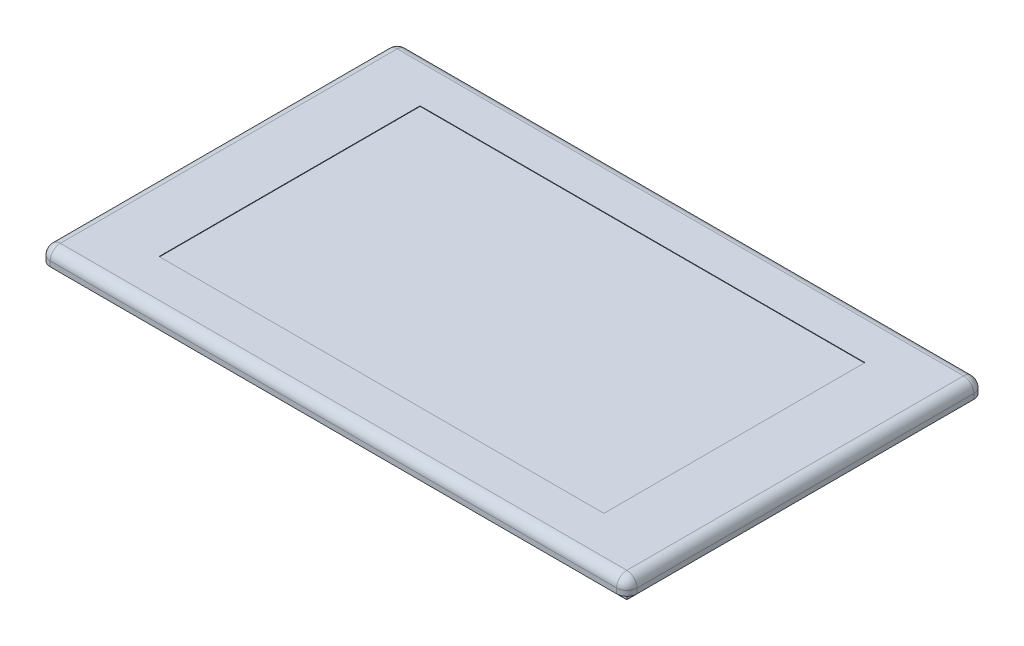
from build123d import *

# Parameters (mm, degrees)
SKETCH1_W           = 115
SKETCH1_H           = 70
BOSS_EXTRUDE1_DEPTH = 3
SKETCH2_W           = 109
SKETCH2_H           = 64
BOSS_EXTRUDE2_DEPTH = 3
FILLET1_R           = 2
SKETCH4_W           = 87.172440104
SKETCH4_H           = 51.155574538
CUT_EXTRUDE1_DEPTH  = 0.1


with BuildPart() as part:
    # Sketch1 → Boss-Extrude1 (new body)
    with BuildSketch(Plane(origin=(0, 0, 0), x_dir=(1, 0, 0), z_dir=(0, 1, 0))):
        Rectangle(SKETCH1_W, SKETCH1_H)
    extrude(amount=BOSS_EXTRUDE1_DEPTH)

    # Sketch2 → Boss-Extrude2 (add)
    with BuildSketch(Plane.XZ):
        Rectangle(SKETCH2_W, SKETCH2_H)
    extrude(amount=BOSS_EXTRUDE2_DEPTH)

    # Fillet1
    fillet1_edges = [part.edges().sort_by_distance(p)[0] for p in [
        (0, 3, 35),
        (-57.5, 3, 0),
        (0, 3, -35),
        (57.5, 3, 0),
        (-57.5, 1.5, 35),
        (-57.5, 1.5, -35),
        (57.5, 1.5, -35),
        (57.5, 1.5, 35),
    ]]
    fillet(fillet1_edges, radius=FILLET1_R)

    # Sketch4 → Cut-Extrude1 (cut)
    with BuildSketch(Plane(origin=(0, 3, 0), x_dir=(1, 0, 0), z_dir=(0, 1, 0))):
        Rectangle(SKETCH4_W, SKETCH4_H)
    extrude(amount=-CUT_EXTRUDE1_DEPTH, mode=Mode.SUBTRACT)


solid = part.part
